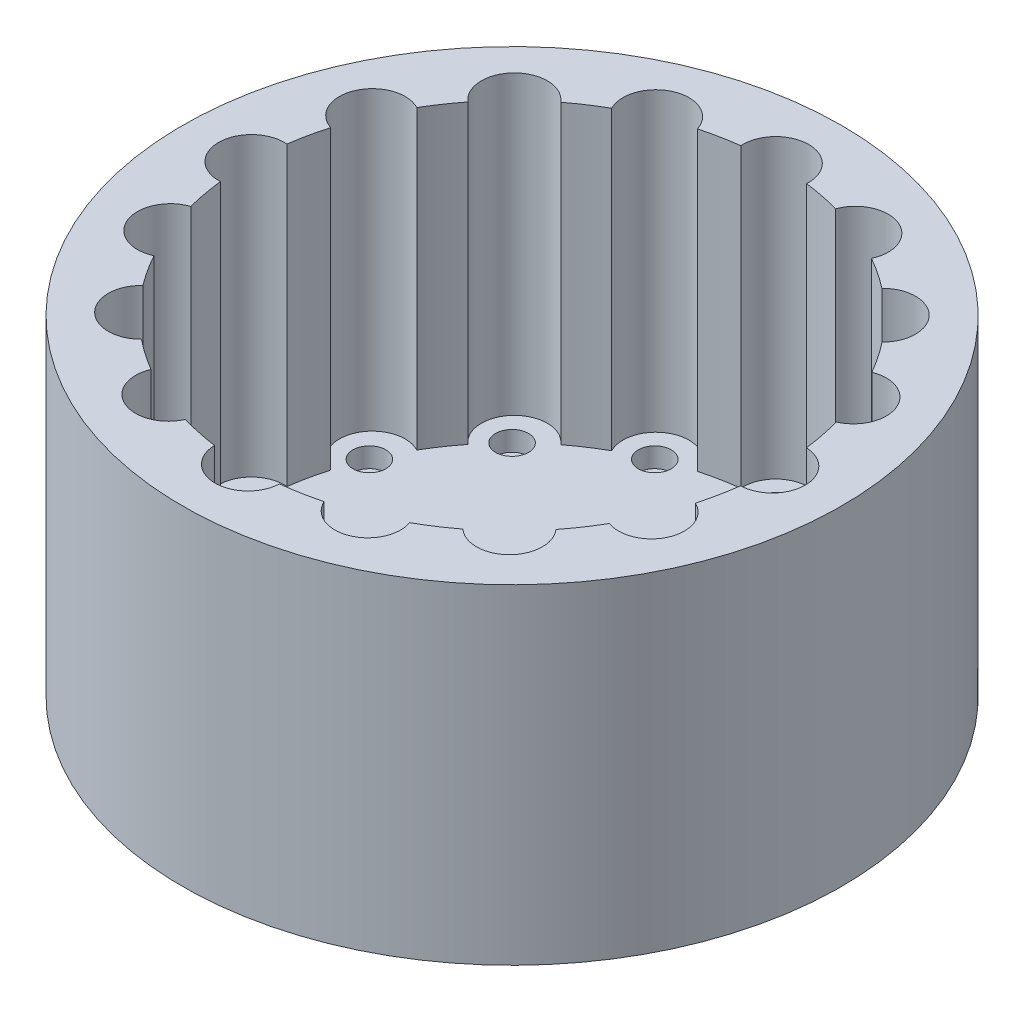
from build123d import *

# Parameters (mm, degrees)
SKETCH1_R           = 50
BOSS_EXTRUDE1_DEPTH = 45
BOSS_EXTRUDE2_START = 5
SKETCH2_R           = 50
BOSS_EXTRUDE2_DEPTH = 5
SKETCH3_R           = 2.5
CUT_EXTRUDE1_DEPTH  = 3


with BuildPart() as part:
    # Sketch1 → Boss-Extrude1 (new body)
    with BuildSketch(Plane(origin=(0, 0, 0), x_dir=(1, 0, 0), z_dir=(0, 1, 0))):
        Circle(SKETCH1_R)
        with BuildLine():
            ThreePointArc((-38.472091197, 10.949803601), (-39.142843019, 8.236373014), (-39.622464899, 5.482725176))
            ThreePointArc((-39.622464899, 5.482725176), (-45.027736203, 0.561560709), (-39.746875, -4.492875219))
            ThreePointArc((-39.746875, -4.492875219), (-39.333953887, -7.269117664), (-38.72736158, -10.009568673))
            ThreePointArc((-38.72736158, -10.009568673), (-41.748946282, -16.583911093), (-35.039748856, -19.292900251))
            ThreePointArc((-35.039748856, -19.292900251), (-33.590491244, -21.718169766), (-31.973653194, -24.035088963))
            ThreePointArc((-31.973653194, -24.035088963), (-32.157729031, -31.176050772), (-25.014492656, -31.213381059))
            ThreePointArc((-25.014492656, -31.213381059), (-22.728868069, -32.915020223), (-20.32789937, -34.449622744))
            ThreePointArc((-20.32789937, -34.449622744), (-17.707258167, -40.991172437), (-11.148020432, -38.415122549))
            ThreePointArc((-11.148020432, -38.415122549), (-8.358901204, -39.11686044), (-5.526568431, -39.6163734))
            ThreePointArc((-5.526568431, -39.6163734), (-0.59402965, -44.528471783), (4.46778962, -39.749702589))
            ThreePointArc((4.46778962, -39.749702589), (7.33562934, -39.321604013), (10.164921368, -38.686875986))
            ThreePointArc((10.164921368, -38.686875986), (16.574401115, -41.242300251), (19.433073291, -34.962203341))
            ThreePointArc((19.433073291, -34.962203341), (21.927230073, -33.454395546), (24.304976528, -31.768980405))
            ThreePointArc((24.304976528, -31.768980405), (31.177616874, -31.629495833), (31.415975195, -24.759573957))
            ThreePointArc((31.415975195, -24.759573957), (33.136656406, -22.404508524), (34.681152562, -19.930320042))
            ThreePointArc((34.681152562, -19.930320042), (40.985236081, -17.155873875), (38.537324177, -10.717959006))
            ThreePointArc((38.537324177, -10.717959006), (39.213686022, -7.892200491), (39.683137427, -5.024798895))
            ThreePointArc((39.683137427, -5.024798895), (44.500790375, -0.031685054), (39.690252613, 4.968284165))
            ThreePointArc((39.690252613, 4.968284165), (39.229069194, 7.815377799), (38.563928149, 10.62183815))
            ThreePointArc((38.563928149, 10.62183815), (41.191547229, 17.128956276), (34.724740733, 19.854278657))
            ThreePointArc((34.724740733, 19.854278657), (33.21843503, 22.283078202), (31.542548716, 24.598122296))
            ThreePointArc((31.542548716, 24.598122296), (31.568070741, 31.71029047), (24.456089141, 31.652799306))
            ThreePointArc((24.456089141, 31.652799306), (22.154728904, 33.304173721), (19.742272443, 34.788542349))
            ThreePointArc((19.742272443, 34.788542349), (17.102427339, 41.494962196), (10.503764758, 38.596255335))
            ThreePointArc((10.503764758, 38.596255335), (7.766185163, 39.238837496), (4.99022482, 39.6875))
            ThreePointArc((4.99022482, 39.6875), (0, 45), (-4.99022482, 39.6875))
            ThreePointArc((-4.99022482, 39.6875), (-7.752560801, 39.241531584), (-10.476960655, 38.603539934))
            ThreePointArc((-10.476960655, 38.603539934), (-17.137978748, 41.698652845), (-19.697351689, 34.813996272))
            ThreePointArc((-19.697351689, 34.813996272), (-22.077028029, 33.355731643), (-24.349225183, 31.735078903))
            ThreePointArc((-24.349225183, 31.735078903), (-31.708929174, 32.096652706), (-31.436823309, 24.733098071))
            ThreePointArc((-31.436823309, 24.733098071), (-33.084428294, 22.481561432), (-34.571077134, 20.120651724))
            ThreePointArc((-34.571077134, 20.120651724), (-41.501374638, 17.653486782), (-38.472091197, 10.949803601))
        make_face(mode=Mode.SUBTRACT)
    extrude(amount=BOSS_EXTRUDE1_DEPTH)

    # Sketch2 → Boss-Extrude2 (add)
    with BuildSketch(Plane.XZ.offset(BOSS_EXTRUDE2_START)):
        Circle(SKETCH2_R)
    extrude(amount=-BOSS_EXTRUDE2_DEPTH)

    # Sketch3 → Cut-Extrude1 (cut)
    with BuildSketch(Plane(origin=(0, 0, 0), x_dir=(1, 0, 0), z_dir=(0, 1, 0))):
        with Locations((0, 40)):
            Circle(SKETCH3_R)
        with Locations((15.307337295, 36.9551813)):
            Circle(SKETCH3_R)
        with Locations((28.284271247, 28.284271247)):
            Circle(SKETCH3_R)
        with Locations((36.9551813, 15.307337295)):
            Circle(SKETCH3_R)
        with Locations((40, 0)):
            Circle(SKETCH3_R)
        with Locations((36.9551813, -15.307337295)):
            Circle(SKETCH3_R)
        with Locations((28.284271247, -28.284271247)):
            Circle(SKETCH3_R)
        with Locations((15.307337295, -36.9551813)):
            Circle(SKETCH3_R)
        with Locations((0, -40)):
            Circle(SKETCH3_R)
        with Locations((-15.307337295, -36.9551813)):
            Circle(SKETCH3_R)
        with Locations((-28.284271247, -28.284271247)):
            Circle(SKETCH3_R)
        with Locations((-36.9551813, -15.307337295)):
            Circle(SKETCH3_R)
        with Locations((-40, 0)):
            Circle(SKETCH3_R)
        with Locations((-36.9551813, 15.307337295)):
            Circle(SKETCH3_R)
        with Locations((-28.284271247, 28.284271247)):
            Circle(SKETCH3_R)
        with Locations((-15.307337295, 36.9551813)):
            Circle(SKETCH3_R)
    extrude(amount=-CUT_EXTRUDE1_DEPTH, mode=Mode.SUBTRACT)


solid = part.part
